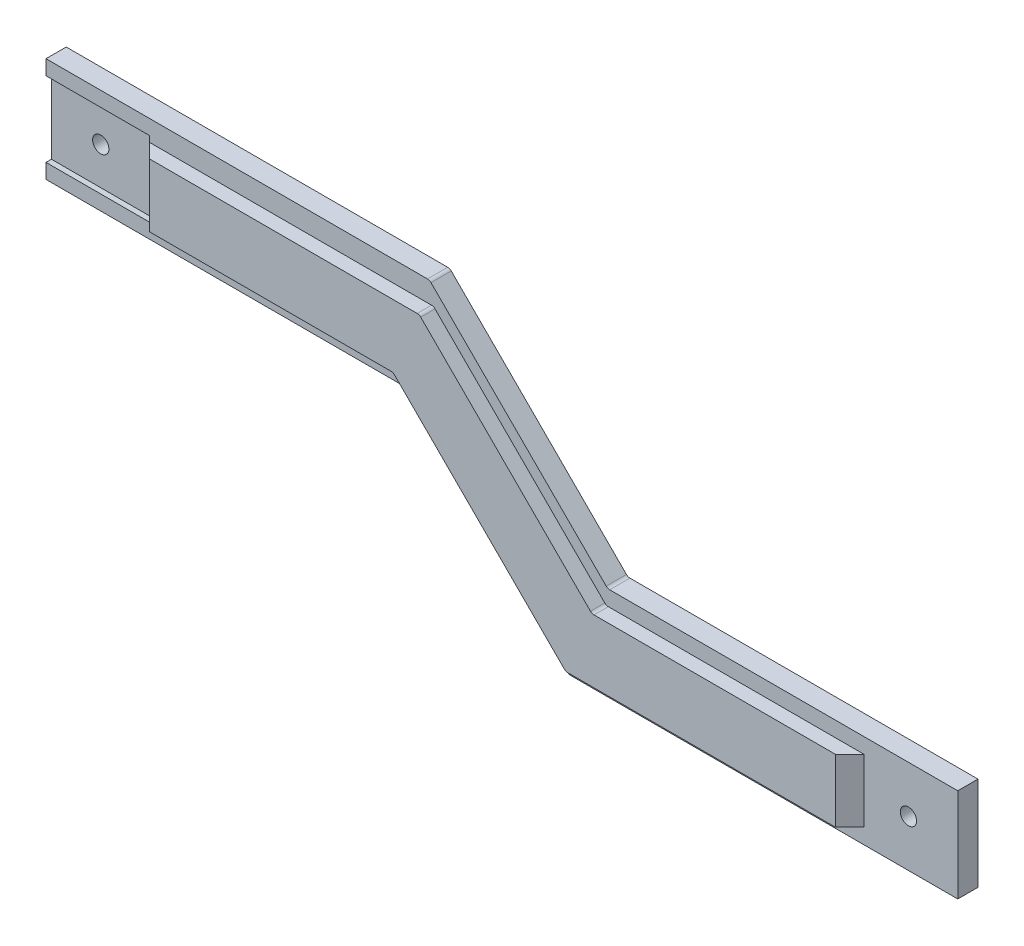
from build123d import *

# Parameters (mm, degrees)
SKETCH_1_R          = 1.65
EXTRUDE_1_DEPTH     = 3
EXTRUDE_2_DEPTH     = 2.9
CHAMFER_1_SIZE      = 2.9
EXTRUDE_START       = -1.1
SKETCH_6_R          = 1.65
EXTRUDE_3_DEPTH     = 4.1
CUT_EXTRUDE_START   = 3
SKETCH_7_W          = 21
SKETCH_7_H          = 15.2
CUT_EXTRUDE_1_DEPTH = 1.1
FILLET_1_R          = 1


with BuildPart() as part:
    # 草图1 → 凸台-拉伸1 (new body)
    with BuildSketch(Plane.XY):
        Polygon((-92.4, 27), (-13.564971157, 27), (21.435028843, -8), (92.4, -8), (92.4, -27), (13.564971157, -27), (-21.435028843, 8), (-92.4, 8), align=None)
        with Locations((-82.4, 17.5)):
            Circle(SKETCH_1_R, mode=Mode.SUBTRACT)
        with Locations((82.4, -17.5)):
            Circle(SKETCH_1_R, mode=Mode.SUBTRACT)
    extrude(amount=EXTRUDE_1_DEPTH)

    # 草图2 → 凸台-拉伸2 (add)
    with BuildSketch(Plane.XY.offset(3)):
        Polygon((-71.4, 23.9), (-71.4, 11.1), (-19.150966799, 11.1), (15.849033201, -23.9), (73.4, -23.9), (73.4, -11.1), (21.150966799, -11.1), (-13.849033201, 23.9), align=None)
    extrude(amount=EXTRUDE_2_DEPTH)

    # 倒角1
    chamfer_1_edges = [part.edges().sort_by_distance(p)[0] for p in [
        (73.4, -17.5, 5.9),
        (-71.4, 17.5, 5.9),
    ]]
    chamfer(chamfer_1_edges, length=CHAMFER_1_SIZE - 0.0001)  # a hair under: the kernel refuses the full size

    # 草图6 → 凸台-拉伸3 (add)
    with BuildSketch(Plane.XY.offset(EXTRUDE_START)):
        Polygon((-92.4, 28.1), (-92.4, 6.9), (-20.335028843, 6.9), (13.564971157, -27), (92.4, -27), (92.4, -8), (21.435028843, -8), (-14.664971157, 28.1), align=None)
        with Locations((-82.4, 17.5)):
            Circle(SKETCH_6_R, mode=Mode.SUBTRACT)
        with Locations((82.4, -17.5)):
            Circle(SKETCH_6_R, mode=Mode.SUBTRACT)
    extrude(amount=EXTRUDE_3_DEPTH)

    # 草图7 → 切除-拉伸1 (cut)
    with BuildSketch(Plane.XY.offset(CUT_EXTRUDE_START)):
        with Locations((-81.9, 17.5)):
            Rectangle(SKETCH_7_W, SKETCH_7_H)
    extrude(amount=-CUT_EXTRUDE_1_DEPTH, mode=Mode.SUBTRACT)

    # 圆角1
    fillet_1_edges = [part.edges().sort_by_distance(p)[0] for p in [
        (21.435028843, -8, 0.95),
        (13.564971157, -27, 0.95),
        (-13.849033201, 23.9, 4.45),
        (-19.150966799, 11.1, 4.45),
        (15.849033201, -23.9, 4.45),
        (21.150966799, -11.1, 4.45),
        (-14.664971157, 28.1, 0.95),
        (-20.335028843, 6.9, 0.95),
    ]]
    fillet(fillet_1_edges, radius=FILLET_1_R)


solid = part.part
